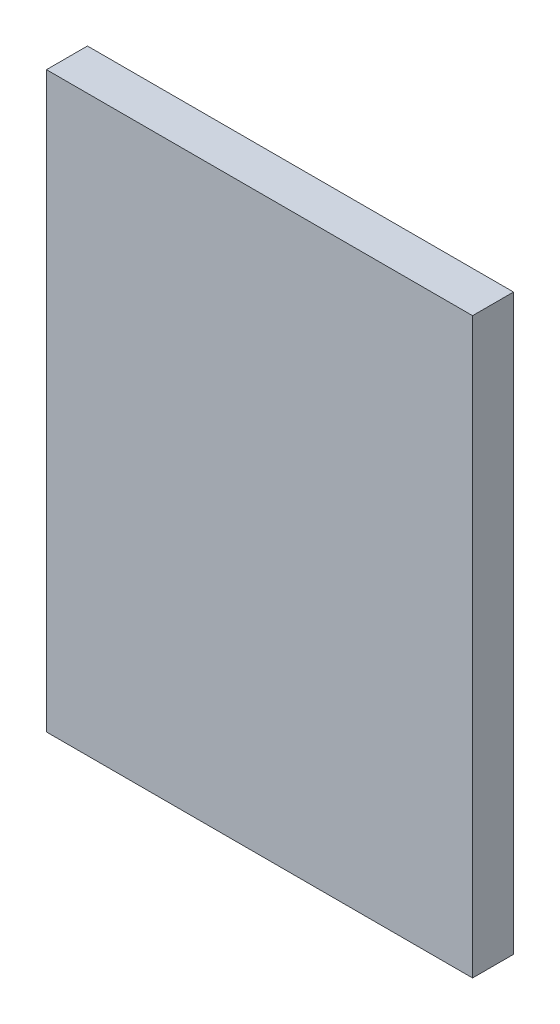
from build123d import *

# Parameters (mm, degrees)
SKETCH1_W           = 104
SKETCH1_H           = 140
BOSS_EXTRUDE1_DEPTH = 10


with BuildPart() as part:
    # Sketch1 → Boss-Extrude1 (new body)
    with BuildSketch(Plane.XY):
        Rectangle(SKETCH1_W, SKETCH1_H)
    extrude(amount=BOSS_EXTRUDE1_DEPTH)


solid = part.part
